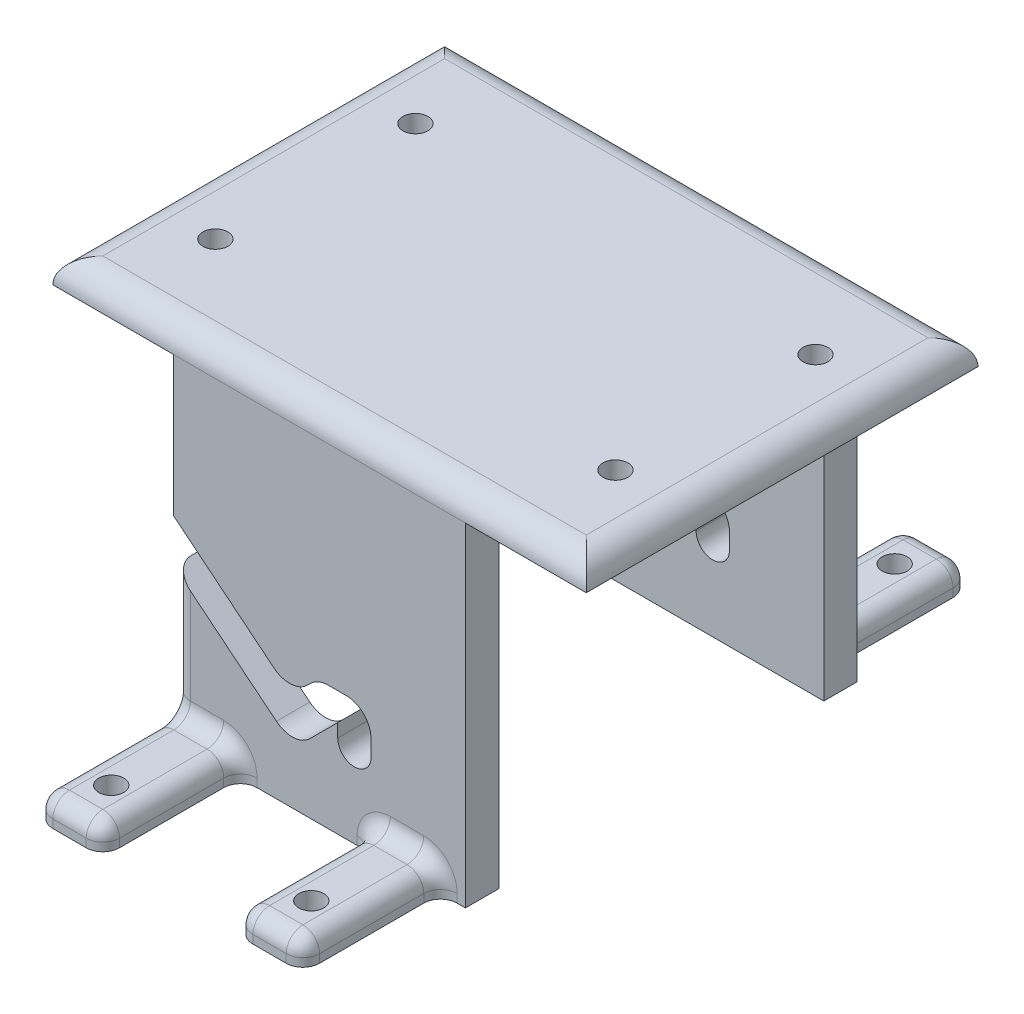
from build123d import *

# Parameters (mm, degrees)
CROQUIS1_W               = 38
CROQUIS1_H               = 62
SALIENTE_EXTRUIR1_DEPTH  = 3
CROQUIS2_R               = 1.5
CORTAR_EXTRUIR1_DEPTH    = 73.780491892
SALIENTE_EXTRUIR2_DEPTH  = 40
REDONDEO2_DEPTH          = 38
REDONDEO2_START          = -1
REDONDEO2_2_DEPTH        = 64
CROQUIS8_W               = 7
CROQUIS8_H               = 7
SALIENTE_EXTRUIR6_DEPTH  = 3
CROQUIS12_R              = 1.5
CROQUIS12_W              = 3
CROQUIS12_H              = 6
CORTAR_EXTRUIR6_DEPTH    = 40
CROQUIS14_W              = 18
CROQUIS14_H              = 20
SALIENTE_EXTRUIR7_DEPTH  = 3
CROQUIS15_W              = 18
CROQUIS15_H              = 20
SALIENTE_EXTRUIR8_DEPTH  = 3
CROQUIS17_W              = 38
CROQUIS17_H              = 2
SALIENTE_EXTRUIR9_DEPTH  = 40
CORTAR_EXTRUIR7_DEPTH    = 89.345911054
REDONDEO3_R              = 3
CROQUIS18_W              = 3
CROQUIS18_H              = 2
CORTAR_EXTRUIR8_DEPTH    = 40
CROQUIS19_W              = 18
CROQUIS19_H              = 20
CORTAR_EXTRUIR9_DEPTH    = 3
CROQUIS20_W              = 18
CROQUIS20_H              = 20
CORTAR_EXTRUIR10_DEPTH   = 3
SALIENTE_EXTRUIR10_DEPTH = 3
SALIENTE_EXTRUIR11_DEPTH = 3
REDONDEO4_R              = 1
CROQUIS23_W              = 62
CROQUIS23_H              = 3
CORTAR_EXTRUIR11_DEPTH   = 88.097646352
CROQUIS24_W              = 64
CROQUIS24_H              = 47
SALIENTE_EXTRUIR12_DEPTH = 3
REDONDEO5_R              = 3
SALIENTE_EXTRUIR13_DEPTH = 2
SALIENTE_EXTRUIR14_DEPTH = 2
CROQUIS27_W              = 8
CROQUIS27_H              = 3
SALIENTE_EXTRUIR15_DEPTH = 16.5
CROQUIS28_R              = 1.5
CORTAR_EXTRUIR12_DEPTH   = 97.939414069
CROQUIS29_W              = 8
CROQUIS29_H              = 3
SALIENTE_EXTRUIR16_DEPTH = 16.5
CROQUIS30_R              = 1.5
CORTAR_EXTRUIR13_DEPTH   = 97.939414069
REDONDEO6_R              = 2
CROQUIS31_R              = 1.5
CORTAR_EXTRUIR14_DEPTH   = 99.21532467


with BuildPart() as part:
    # Croquis1 → Saliente-Extruir1 (new body)
    with BuildSketch(Plane(origin=(0, 0, 0), x_dir=(1, 0, 0), z_dir=(0, 1, 0))):
        with Locations((19, -31)):
            Rectangle(CROQUIS1_W, CROQUIS1_H)
    extrude(amount=SALIENTE_EXTRUIR1_DEPTH)

    # Croquis2 → Cortar-Extruir1 (cut, through all)
    with BuildSketch(Plane(origin=(0, 3, 0), x_dir=(1, 0, 0), z_dir=(0, 1, 0))):
        with Locations(Location((7, -7, 0), (0, 0, 270))):
            Circle(CROQUIS2_R)
        with Locations(Location((31, -7, 0), (0, 0, 270))):
            Circle(CROQUIS2_R)
        with Locations(Location((7, -55, 0), (0, 0, 270))):
            Circle(CROQUIS2_R)
        with Locations(Location((31, -55, 0), (0, 0, 270))):
            Circle(CROQUIS2_R)
    extrude(amount=-CORTAR_EXTRUIR1_DEPTH, mode=Mode.SUBTRACT)

    # Croquis3 → Saliente-Extruir2 (add)
    with BuildSketch(Plane.XZ):
        Polygon((38, 62), (38, 56), (35, 56), (35, 59), (28, 59), (28, 62), align=None)
        Polygon((0, 62), (10, 62), (10, 59), (3, 59), (3, 56), (0, 56), align=None)
        Polygon((0, 6), (0, 0), (10, 0), (10, 3), (3, 3), (3, 6), align=None)
        Polygon((28, 0), (38, 0), (38, 6), (35, 6), (35, 3), (28, 3), align=None)
    extrude(amount=SALIENTE_EXTRUIR2_DEPTH)

    # Redondeo2: read off the stored shape, not the designer's step
    # Redondeo2 outline → Redondeo2 (cut)
    with BuildSketch(Plane.YZ):
        with BuildLine():
            ThreePointArc((0, 62), (2.121320344, 61.121320344), (3, 59))
            Line((3, 59), (3, 62))
            Line((3, 62), (0, 62))
        make_face()
        with BuildLine():
            ThreePointArc((3, 3), (2.121320344, 0.878679656), (0, 0))
            Line((0, 0), (3, 0))
            Line((3, 0), (3, 3))
        make_face()
    extrude(amount=REDONDEO2_DEPTH, mode=Mode.SUBTRACT)

    # Redondeo2 2 outline → Redondeo2 2 (cut)
    with BuildSketch(Plane.XY.offset(REDONDEO2_START)):
        with BuildLine():
            Line((0, 3), (0, 0))
            ThreePointArc((0, 0), (0.878679656, 2.121320344), (3, 3))
            Line((3, 3), (0, 3))
        make_face()
        with BuildLine():
            Line((38, 3), (35, 3))
            ThreePointArc((35, 3), (37.121320344, 2.121320344), (38, 0))
            Line((38, 0), (38, 3))
        make_face()
    extrude(amount=REDONDEO2_2_DEPTH, mode=Mode.SUBTRACT)

    # Croquis8 → Saliente-Extruir6 (add)
    with BuildSketch(Plane.XZ.offset(40)):
        with Locations((6.5, 65.5)):
            Rectangle(CROQUIS8_W, CROQUIS8_H)
        with Locations((31.5, 65.5)):
            Rectangle(CROQUIS8_W, CROQUIS8_H)
        with Locations((31.5, -3.5)):
            Rectangle(CROQUIS8_W, CROQUIS8_H)
        with Locations((6.5, -3.5)):
            Rectangle(CROQUIS8_W, CROQUIS8_H)
    extrude(amount=-SALIENTE_EXTRUIR6_DEPTH)

    # Croquis12 → Cortar-Extruir6 (cut)
    with BuildSketch(Plane.XZ.offset(40)):
        with Locations(Location((7, -4, 0), (0, 0, 270))):
            Circle(CROQUIS12_R)
        with Locations(Location((31, -4, 0), (0, 0, 270))):
            Circle(CROQUIS12_R)
        with Locations(Location((31, 66, 0), (0, 0, 270))):
            Circle(CROQUIS12_R)
        with Locations(Location((7, 66, 0), (0, 0, 270))):
            Circle(CROQUIS12_R)
        with Locations((36.5, 3)):
            Rectangle(CROQUIS12_W, CROQUIS12_H)
        with Locations((36.5, 59)):
            Rectangle(CROQUIS12_W, CROQUIS12_H)
        with Locations((1.5, 59)):
            Rectangle(CROQUIS12_W, CROQUIS12_H)
        with Locations((1.5, 3)):
            Rectangle(CROQUIS12_W, CROQUIS12_H)
    extrude(amount=-CORTAR_EXTRUIR6_DEPTH, mode=Mode.SUBTRACT)

    # Croquis14 → Saliente-Extruir7 (add)
    with BuildSketch(Plane(origin=(0, 0, 59), x_dir=(-1, 0, 0), z_dir=(0, 0, -1))):
        with Locations((-19, -30)):
            Rectangle(CROQUIS14_W, CROQUIS14_H)
    extrude(amount=-SALIENTE_EXTRUIR7_DEPTH)

    # Croquis15 → Saliente-Extruir8 (add)
    with BuildSketch(Plane.XY.offset(3)):
        with Locations((19, -30)):
            Rectangle(CROQUIS15_W, CROQUIS15_H)
    extrude(amount=-SALIENTE_EXTRUIR8_DEPTH)

    # Croquis17 → Saliente-Extruir9 (add)
    with BuildSketch(Plane.XZ):
        with Locations((19, 10.5)):
            Rectangle(CROQUIS17_W, CROQUIS17_H)
        with Locations((19, 51.5)):
            Rectangle(CROQUIS17_W, CROQUIS17_H)
    extrude(amount=SALIENTE_EXTRUIR9_DEPTH)

    # Croquis16 → Cortar-Extruir7 (cut, through all)
    with BuildSketch(Plane(origin=(0, 0, 0), x_dir=(-1, 0, 0), z_dir=(0, 0, -1))):
        with BuildLine():
            Line((-17.42778873, -33.646749521), (-3, -21.929542881))
            Line((-3, -21.929542881), (-3, -16.776599839))
            Line((-3, -16.776599839), (-17.113112675, -28.238249343))
            Line((-17.113112675, -28.238249343), (-20.299570201, -25.079703159))
            Line((-20.299570201, -25.079703159), (-26.67778873, -25.079703159))
            Line((-26.67778873, -25.079703159), (-26.67778873, -30))
            ThreePointArc((-26.67778873, -30), (-24.67778873, -32), (-22.67778873, -30))
            Line((-22.67778873, -30), (-22.67778873, -28.396749521))
            Line((-22.67778873, -28.396749521), (-17.42778873, -33.646749521))
        make_face()
    extrude(amount=-CORTAR_EXTRUIR7_DEPTH, mode=Mode.SUBTRACT)

    # Redondeo3
    redondeo3_edges = [part.edges().sort_by_distance(p)[0] for p in [
        (26.67778873, -25.079703159, 60.5),
        (26.67778873, -25.079703159, 1.5),
        (26.67778873, -25.079703159, 10.5),
        (26.67778873, -25.079703159, 51.5),
        (20.299570201, -25.079703159, 60.5),
        (20.299570201, -25.079703159, 1.5),
        (20.299570201, -25.079703159, 10.5),
        (20.299570201, -25.079703159, 51.5),
        (17.113112675, -28.238249343, 60.5),
        (17.113112675, -28.238249343, 1.5),
        (17.113112675, -28.238249343, 10.5),
        (17.113112675, -28.238249343, 51.5),
        (17.42778873, -33.646749521, 60.5),
        (17.42778873, -33.646749521, 1.5),
        (17.42778873, -33.646749521, 10.5),
        (17.42778873, -33.646749521, 51.5),
    ]]
    fillet(redondeo3_edges, radius=REDONDEO3_R)

    # Croquis18 → Cortar-Extruir8 (cut)
    with BuildSketch(Plane.XZ.offset(40)):
        with Locations((1.5, 51.5)):
            Rectangle(CROQUIS18_W, CROQUIS18_H)
        with Locations((1.5, 10.5)):
            Rectangle(CROQUIS18_W, CROQUIS18_H)
    extrude(amount=-CORTAR_EXTRUIR8_DEPTH, mode=Mode.SUBTRACT)

    # Croquis19 → Cortar-Extruir9 (cut)
    with BuildSketch(Plane(origin=(0, 0, 0), x_dir=(-1, 0, 0), z_dir=(0, 0, -1))):
        with Locations((-19, -30)):
            Rectangle(CROQUIS19_W, CROQUIS19_H)
    extrude(amount=-CORTAR_EXTRUIR9_DEPTH, mode=Mode.SUBTRACT)


with BuildPart() as cortar_extruir9_piece_1:
    # of the separate pieces the step leaves, piece 1, a body of its own (cortar_extruir9_pieces)
    add(part.part.solids().sort_by_distance((3, -16.776599839, 0))[0])

    # Croquis20 → Cortar-Extruir10 (cut)
    with BuildSketch(Plane.XY.offset(62)):
        with Locations((19, -30)):
            Rectangle(CROQUIS20_W, CROQUIS20_H)
    extrude(amount=-CORTAR_EXTRUIR10_DEPTH, mode=Mode.SUBTRACT)


with BuildPart() as cortar_extruir9_piece_2:
    # of the separate pieces the step leaves, piece 2, a body of its own (cortar_extruir9_pieces)
    add(part.part.solids().sort_by_distance((10, -27.614436666, 0))[0])



with BuildPart() as cortar_extruir10_piece_1:
    # of the separate pieces the step leaves, piece 1, a body of its own (cortar_extruir10_pieces)
    add(cortar_extruir9_piece_1.part.solids().sort_by_distance((3, -16.776599839, 0))[0])



with BuildPart() as cortar_extruir10_piece_2:
    # of the separate pieces the step leaves, piece 2, a body of its own (cortar_extruir10_pieces)
    add(cortar_extruir9_piece_1.part.solids().sort_by_distance((10, -27.614436666, 59))[0])


with BuildPart() as cortar_extruir10_piece_1_1:
    add(cortar_extruir10_piece_1.part)

    add(cortar_extruir10_piece_2.part)  # Saliente-Extruir10 merges Cortar-Extruir10 piece 2
    # Croquis21 → Saliente-Extruir10 (add)
    with BuildSketch(Plane.XY.offset(62)):
        Polygon((3, -16.776599839), (3, -21.929542881), (10, -27.614436666), (10, -22.461493624), align=None)
    extrude(amount=-SALIENTE_EXTRUIR10_DEPTH)


with BuildPart() as cortar_extruir9_piece_2_1:
    add(cortar_extruir9_piece_2.part)

    add(cortar_extruir10_piece_1_1.part)  # Saliente-Extruir11 merges Cortar-Extruir10 piece 1
    # Croquis22 → Saliente-Extruir11 (add)
    with BuildSketch(Plane(origin=(0, 0, 0), x_dir=(-1, 0, 0), z_dir=(0, 0, -1))):
        Polygon((-10, -22.461493624), (-3, -16.776599839), (-3, -21.929542881), (-10, -27.614436666), align=None)
    extrude(amount=-SALIENTE_EXTRUIR11_DEPTH)

    # Redondeo4
    # the kernel refuses this fillet: 1 mm, written as the material it adds along each edge
    with BuildSketch(Plane(origin=(10, -37, 0), x_dir=(0, 1, 0), z_dir=(-1, 0, 0)), Plane(origin=(28, -37, 62), x_dir=(0, 1, 0), z_dir=(1, 0, 0))) as redondeo4_piece_1:
        with BuildLine():
            CenterArc((REDONDEO4_R, REDONDEO4_R), REDONDEO4_R, 180, 90)
            Line((0, REDONDEO4_R), (0, 0))
            Line((0, 0), (REDONDEO4_R, 0))
        make_face()
    extrude(amount=7)
    with BuildSketch(Plane(origin=(28, -37, 0), x_dir=(0, 1, 0), z_dir=(1, 0, 0)), Plane(origin=(10, -37, 62), x_dir=(0, 1, 0), z_dir=(-1, 0, 0))) as redondeo4_piece_2:
        with BuildLine():
            CenterArc((REDONDEO4_R, -REDONDEO4_R), REDONDEO4_R, 90, 90)
            Line((0, -REDONDEO4_R), (0, 0))
            Line((0, 0), (REDONDEO4_R, 0))
        make_face()
    extrude(amount=7)
    # the kernel refuses this fillet: 1 mm, written as the material it takes off along each edge
    with BuildSketch(Plane(origin=(0.5, -37, -7), x_dir=(0, -1, 0), z_dir=(1, 0, 0)), Plane(origin=(37.5, -37, 69), x_dir=(0, -1, 0), z_dir=(-1, 0, 0))) as redondeo4_2_piece_1:
        with BuildLine():
            CenterArc((REDONDEO4_R, -REDONDEO4_R), REDONDEO4_R, 90, 90)
            Line((0, -REDONDEO4_R), (0, 0))
            Line((0, 0), (REDONDEO4_R, 0))
        make_face()
    extrude(amount=12, mode=Mode.SUBTRACT)
    with BuildSketch(Plane(origin=(10, -42.5, -7), x_dir=(0, 0, 1), z_dir=(0, 1, 0)), Plane(origin=(28, -42.5, 69), x_dir=(0, 0, -1), z_dir=(0, 1, 0)), Plane(origin=(35, -42.5, -7), x_dir=(0, 0, 1), z_dir=(0, 1, 0)), Plane(origin=(3, -42.5, 69), x_dir=(0, 0, -1), z_dir=(0, 1, 0))) as redondeo4_2_piece_2:
        with BuildLine():
            CenterArc((REDONDEO4_R, -REDONDEO4_R), REDONDEO4_R, 90, 90)
            Line((0, -REDONDEO4_R), (0, 0))
            Line((0, 0), (REDONDEO4_R, 0))
        make_face()
    extrude(amount=8, mode=Mode.SUBTRACT)
    with BuildSketch(Plane(origin=(3, -42.5, -7), x_dir=(0, 0, 1), z_dir=(0, 1, 0)), Plane(origin=(28, -42.5, -7), x_dir=(0, 0, 1), z_dir=(0, 1, 0)), Plane(origin=(10, -42.5, 69), x_dir=(0, 0, -1), z_dir=(0, 1, 0)), Plane(origin=(35, -42.5, 69), x_dir=(0, 0, -1), z_dir=(0, 1, 0))) as redondeo4_2_piece_3:
        with BuildLine():
            CenterArc((REDONDEO4_R, REDONDEO4_R), REDONDEO4_R, 180, 90)
            Line((0, REDONDEO4_R), (0, 0))
            Line((0, 0), (REDONDEO4_R, 0))
        make_face()
    extrude(amount=8, mode=Mode.SUBTRACT)
    with BuildSketch(Plane(origin=(37.5, -37, -7), x_dir=(0, -1, 0), z_dir=(-1, 0, 0)), Plane(origin=(0.5, -37, 69), x_dir=(0, -1, 0), z_dir=(1, 0, 0))) as redondeo4_2_piece_4:
        with BuildLine():
            CenterArc((REDONDEO4_R, REDONDEO4_R), REDONDEO4_R, 180, 90)
            Line((0, REDONDEO4_R), (0, 0))
            Line((0, 0), (REDONDEO4_R, 0))
        make_face()
    extrude(amount=12, mode=Mode.SUBTRACT)
    # the kernel refuses this fillet: 1 mm, written as the material it takes off along each edge
    with BuildSketch(Plane(origin=(34, -38, -6), x_dir=(0, 1, 0), z_dir=(1, 0, 0))) as redondeo4_3_piece_1_section:
        Polygon((0, 0), (REDONDEO4_R, 0), (REDONDEO4_R, -REDONDEO4_R), (0, -REDONDEO4_R), align=None)
    redondeo4_3_piece_1 = extrude(amount=REDONDEO4_R, mode=Mode.PRIVATE)
    redondeo4_3_piece_1 = redondeo4_3_piece_1 - Plane(origin=(34, -38, -6), x_dir=(0, -0.7071067811865475, 0.7071067811865475), z_dir=(1, 0, 0)) * Sphere(REDONDEO4_R, mode=Mode.PRIVATE)
    add(redondeo4_3_piece_1, mode=Mode.SUBTRACT)
    with BuildSketch(Plane(origin=(34, -38, 68), x_dir=(0, 1, 0), z_dir=(1, 0, 0))) as redondeo4_3_piece_2_section:
        Polygon((0, 0), (REDONDEO4_R, 0), (REDONDEO4_R, REDONDEO4_R), (0, REDONDEO4_R), align=None)
    redondeo4_3_piece_2 = extrude(amount=REDONDEO4_R, mode=Mode.PRIVATE)
    redondeo4_3_piece_2 = redondeo4_3_piece_2 - Plane(origin=(34, -38, 68), x_dir=(0, -0.7071067811865475, -0.7071067811865475), z_dir=(1, 0, 0)) * Sphere(REDONDEO4_R, mode=Mode.PRIVATE)
    add(redondeo4_3_piece_2, mode=Mode.SUBTRACT)
    with BuildSketch(Plane(origin=(9, -38, 68), x_dir=(0, 1, 0), z_dir=(1, 0, 0))) as redondeo4_3_piece_3_section:
        Polygon((0, 0), (REDONDEO4_R, 0), (REDONDEO4_R, REDONDEO4_R), (0, REDONDEO4_R), align=None)
    redondeo4_3_piece_3 = extrude(amount=REDONDEO4_R, mode=Mode.PRIVATE)
    redondeo4_3_piece_3 = redondeo4_3_piece_3 - Plane(origin=(9, -38, 68), x_dir=(0, -0.7071067811865475, -0.7071067811865475), z_dir=(1, 0, 0)) * Sphere(REDONDEO4_R, mode=Mode.PRIVATE)
    add(redondeo4_3_piece_3, mode=Mode.SUBTRACT)
    with BuildSketch(Plane(origin=(29, -38, 68), x_dir=(0, 1, 0), z_dir=(-1, 0, 0))) as redondeo4_3_piece_4_section:
        Polygon((0, 0), (REDONDEO4_R, 0), (REDONDEO4_R, -REDONDEO4_R), (0, -REDONDEO4_R), align=None)
    redondeo4_3_piece_4 = extrude(amount=REDONDEO4_R, mode=Mode.PRIVATE)
    redondeo4_3_piece_4 = redondeo4_3_piece_4 - Plane(origin=(29, -38, 68), x_dir=(0, -0.7071067811865475, -0.7071067811865475), z_dir=(-1, 0, 0)) * Sphere(REDONDEO4_R, mode=Mode.PRIVATE)
    add(redondeo4_3_piece_4, mode=Mode.SUBTRACT)
    with BuildSketch(Plane(origin=(29, -38, -6), x_dir=(0, 1, 0), z_dir=(-1, 0, 0))) as redondeo4_3_piece_5_section:
        Polygon((0, 0), (REDONDEO4_R, 0), (REDONDEO4_R, REDONDEO4_R), (0, REDONDEO4_R), align=None)
    redondeo4_3_piece_5 = extrude(amount=REDONDEO4_R, mode=Mode.PRIVATE)
    redondeo4_3_piece_5 = redondeo4_3_piece_5 - Plane(origin=(29, -38, -6), x_dir=(0, -0.7071067811865475, 0.7071067811865475), z_dir=(-1, 0, 0)) * Sphere(REDONDEO4_R, mode=Mode.PRIVATE)
    add(redondeo4_3_piece_5, mode=Mode.SUBTRACT)
    with BuildSketch(Plane(origin=(4, -38, 68), x_dir=(0, 1, 0), z_dir=(-1, 0, 0))) as redondeo4_3_piece_6_section:
        Polygon((0, 0), (REDONDEO4_R, 0), (REDONDEO4_R, -REDONDEO4_R), (0, -REDONDEO4_R), align=None)
    redondeo4_3_piece_6 = extrude(amount=REDONDEO4_R, mode=Mode.PRIVATE)
    redondeo4_3_piece_6 = redondeo4_3_piece_6 - Plane(origin=(4, -38, 68), x_dir=(0, -0.7071067811865475, -0.7071067811865475), z_dir=(-1, 0, 0)) * Sphere(REDONDEO4_R, mode=Mode.PRIVATE)
    add(redondeo4_3_piece_6, mode=Mode.SUBTRACT)
    with BuildSketch(Plane(origin=(4, -38, -6), x_dir=(0, 1, 0), z_dir=(-1, 0, 0))) as redondeo4_3_piece_7_section:
        Polygon((0, 0), (REDONDEO4_R, 0), (REDONDEO4_R, REDONDEO4_R), (0, REDONDEO4_R), align=None)
    redondeo4_3_piece_7 = extrude(amount=REDONDEO4_R, mode=Mode.PRIVATE)
    redondeo4_3_piece_7 = redondeo4_3_piece_7 - Plane(origin=(4, -38, -6), x_dir=(0, -0.7071067811865475, 0.7071067811865475), z_dir=(-1, 0, 0)) * Sphere(REDONDEO4_R, mode=Mode.PRIVATE)
    add(redondeo4_3_piece_7, mode=Mode.SUBTRACT)
    with BuildSketch(Plane(origin=(9, -38, -6), x_dir=(0, 1, 0), z_dir=(1, 0, 0))) as redondeo4_3_piece_8_section:
        Polygon((0, 0), (REDONDEO4_R, 0), (REDONDEO4_R, -REDONDEO4_R), (0, -REDONDEO4_R), align=None)
    redondeo4_3_piece_8 = extrude(amount=REDONDEO4_R, mode=Mode.PRIVATE)
    redondeo4_3_piece_8 = redondeo4_3_piece_8 - Plane(origin=(9, -38, -6), x_dir=(0, -0.7071067811865475, 0.7071067811865475), z_dir=(1, 0, 0)) * Sphere(REDONDEO4_R, mode=Mode.PRIVATE)
    add(redondeo4_3_piece_8, mode=Mode.SUBTRACT)
    with BuildSketch(Plane(origin=(10, -37, -6), x_dir=(0, -1, 0), z_dir=(0, 0, 1)), Plane(origin=(3, -37, -1), x_dir=(0, -1, 0), z_dir=(0, 0, -1)), Plane(origin=(28, -37, 68), x_dir=(0, -1, 0), z_dir=(0, 0, -1)), Plane(origin=(35, -37, 63), x_dir=(0, -1, 0), z_dir=(0, 0, 1))) as redondeo4_3_piece_9:
        with BuildLine():
            CenterArc((REDONDEO4_R, -REDONDEO4_R), REDONDEO4_R, 90, 90)
            Line((0, -REDONDEO4_R), (0, 0))
            Line((0, 0), (REDONDEO4_R, 0))
        make_face()
    extrude(amount=5, mode=Mode.SUBTRACT)
    with BuildSketch(Plane(origin=(3, 0, 0), x_dir=(0, 0, 1), z_dir=(0, -1, 0)), Plane(origin=(10, -36, 0), x_dir=(0, 0, 1), z_dir=(0, 1, 0)), Plane(origin=(35, -36, 0), x_dir=(0, 0, 1), z_dir=(0, 1, 0)), Plane(origin=(28, -36, 62), x_dir=(0, 0, -1), z_dir=(0, 1, 0)), Plane(origin=(3, -36, 62), x_dir=(0, 0, -1), z_dir=(0, 1, 0)), Plane(origin=(10, 0, 62), x_dir=(0, 0, -1), z_dir=(0, -1, 0))) as redondeo4_3_piece_10:
        with BuildLine():
            CenterArc((REDONDEO4_R, -REDONDEO4_R), REDONDEO4_R, 90, 90)
            Line((0, -REDONDEO4_R), (0, 0))
            Line((0, 0), (REDONDEO4_R, 0))
        make_face()
    extrude(amount=36, mode=Mode.SUBTRACT)
    with BuildSketch(Plane(origin=(28, -36, 0), x_dir=(0, 0, 1), z_dir=(0, 1, 0)), Plane(origin=(35, -36, 62), x_dir=(0, 0, -1), z_dir=(0, 1, 0))) as redondeo4_3_piece_11:
        with BuildLine():
            CenterArc((REDONDEO4_R, REDONDEO4_R), REDONDEO4_R, 180, 90)
            Line((0, REDONDEO4_R), (0, 0))
            Line((0, 0), (REDONDEO4_R, 0))
        make_face()
    extrude(amount=36, mode=Mode.SUBTRACT)
    with BuildSketch(Plane(origin=(3, -37, 63), x_dir=(0, -1, 0), z_dir=(0, 0, 1)), Plane(origin=(28, -37, -6), x_dir=(0, -1, 0), z_dir=(0, 0, 1)), Plane(origin=(10, -37, 68), x_dir=(0, -1, 0), z_dir=(0, 0, -1)), Plane(origin=(35, -37, -1), x_dir=(0, -1, 0), z_dir=(0, 0, -1))) as redondeo4_3_piece_12:
        with BuildLine():
            CenterArc((REDONDEO4_R, REDONDEO4_R), REDONDEO4_R, 180, 90)
            Line((0, REDONDEO4_R), (0, 0))
            Line((0, 0), (REDONDEO4_R, 0))
        make_face()
    extrude(amount=5, mode=Mode.SUBTRACT)
    with BuildSketch(Plane(origin=(35, -36, -1), x_dir=(0, 0, 1), z_dir=(0, 1, 0))) as redondeo4_3_piece_13:
        with BuildLine():
            CenterArc((1 + REDONDEO4_R, -REDONDEO4_R), REDONDEO4_R, 90, 90)
            Line((1, -REDONDEO4_R), (1, 0))
            Line((1, 0), (1 + REDONDEO4_R, 0))
        make_face()
    revolve(axis=Axis((35, -36, -1), (1, 0, 0)), revolution_arc=90, mode=Mode.SUBTRACT)
    with BuildSketch(Plane(origin=(35, -36, 63), x_dir=(0, 0, -1), z_dir=(0, 1, 0))) as redondeo4_3_piece_14:
        with BuildLine():
            CenterArc((1 + REDONDEO4_R, REDONDEO4_R), REDONDEO4_R, 180, 90)
            Line((1, REDONDEO4_R), (1, 0))
            Line((1, 0), (1 + REDONDEO4_R, 0))
        make_face()
    revolve(axis=Axis((35, -36, 63), (-1, 0, 0)), revolution_arc=90, mode=Mode.SUBTRACT)
    with BuildSketch(Plane(origin=(10, -36, 63), x_dir=(0, 0, -1), z_dir=(0, 1, 0))) as redondeo4_3_piece_15:
        with BuildLine():
            CenterArc((1 + REDONDEO4_R, REDONDEO4_R), REDONDEO4_R, 180, 90)
            Line((1, REDONDEO4_R), (1, 0))
            Line((1, 0), (1 + REDONDEO4_R, 0))
        make_face()
    revolve(axis=Axis((10, -36, 63), (-1, 0, 0)), revolution_arc=90, mode=Mode.SUBTRACT)
    with BuildSketch(Plane(origin=(3, -36, 63), x_dir=(0, 0, -1), z_dir=(0, 1, 0))) as redondeo4_3_piece_16:
        with BuildLine():
            CenterArc((1 + REDONDEO4_R, -REDONDEO4_R), REDONDEO4_R, 90, 90)
            Line((1, -REDONDEO4_R), (1, 0))
            Line((1, 0), (1 + REDONDEO4_R, 0))
        make_face()
    revolve(axis=Axis((3, -36, 63), (-1, 0, 0)), revolution_arc=90, mode=Mode.SUBTRACT)
    with BuildSketch(Plane(origin=(28, -36, 63), x_dir=(0, 0, -1), z_dir=(0, 1, 0))) as redondeo4_3_piece_17:
        with BuildLine():
            CenterArc((1 + REDONDEO4_R, -REDONDEO4_R), REDONDEO4_R, 90, 90)
            Line((1, -REDONDEO4_R), (1, 0))
            Line((1, 0), (1 + REDONDEO4_R, 0))
        make_face()
    revolve(axis=Axis((28, -36, 63), (-1, 0, 0)), revolution_arc=90, mode=Mode.SUBTRACT)
    with BuildSketch(Plane(origin=(28, -36, -1), x_dir=(0, 0, 1), z_dir=(0, 1, 0))) as redondeo4_3_piece_18:
        with BuildLine():
            CenterArc((1 + REDONDEO4_R, REDONDEO4_R), REDONDEO4_R, 180, 90)
            Line((1, REDONDEO4_R), (1, 0))
            Line((1, 0), (1 + REDONDEO4_R, 0))
        make_face()
    revolve(axis=Axis((28, -36, -1), (1, 0, 0)), revolution_arc=90, mode=Mode.SUBTRACT)
    with BuildSketch(Plane(origin=(10, -36, -1), x_dir=(0, 0, 1), z_dir=(0, 1, 0))) as redondeo4_3_piece_19:
        with BuildLine():
            CenterArc((1 + REDONDEO4_R, -REDONDEO4_R), REDONDEO4_R, 90, 90)
            Line((1, -REDONDEO4_R), (1, 0))
            Line((1, 0), (1 + REDONDEO4_R, 0))
        make_face()
    revolve(axis=Axis((10, -36, -1), (1, 0, 0)), revolution_arc=90, mode=Mode.SUBTRACT)
    with BuildSketch(Plane(origin=(3, -36, -1), x_dir=(0, 0, 1), z_dir=(0, 1, 0))) as redondeo4_3_piece_20:
        with BuildLine():
            CenterArc((1 + REDONDEO4_R, REDONDEO4_R), REDONDEO4_R, 180, 90)
            Line((1, REDONDEO4_R), (1, 0))
            Line((1, 0), (1 + REDONDEO4_R, 0))
        make_face()
    revolve(axis=Axis((3, -36, -1), (1, 0, 0)), revolution_arc=90, mode=Mode.SUBTRACT)

    # Croquis23 → Cortar-Extruir11 (cut, through all)
    with BuildSketch(Plane.ZY.offset(-3)):
        with Locations((31, 1.5)):
            Rectangle(CROQUIS23_W, CROQUIS23_H)
    extrude(amount=-CORTAR_EXTRUIR11_DEPTH, mode=Mode.SUBTRACT)


with BuildPart() as cortar_extruir11_piece_1:
    # of the separate pieces the step leaves, piece 1, a body of its own (cortar_extruir11_pieces_kept)
    add(cortar_extruir9_piece_2_1.part.solids().sort_by_distance((3, -16.776599839, 50.5))[0])



with BuildPart() as cortar_extruir11_piece_2:
    # of the separate pieces the step leaves, piece 2, a body of its own (cortar_extruir11_pieces_kept)
    add(cortar_extruir9_piece_2_1.part.solids().sort_by_distance((15.327975342, -31.941432938, 9.5))[0])


with BuildPart() as cortar_extruir11_piece_1_1:
    add(cortar_extruir11_piece_1.part)

    add(cortar_extruir11_piece_2.part)  # Saliente-Extruir12 merges Cortar-Extruir11 piece 2
    # Croquis24 → Saliente-Extruir12 (add)
    with BuildSketch(Plane(origin=(0, 0, 0), x_dir=(1, 0, 0), z_dir=(0, 1, 0))):
        with Locations((20.5, -31)):
            Rectangle(CROQUIS24_W, CROQUIS24_H)
    extrude(amount=SALIENTE_EXTRUIR12_DEPTH)

    # Redondeo5
    redondeo5_edges = [cortar_extruir11_piece_1_1.edges().sort_by_distance(p)[0] for p in [
        (20.5, 3, 54.5),
        (-11.5, 3, 31),
        (20.5, 3, 7.5),
        (52.5, 3, 31),
    ]]
    fillet(redondeo5_edges, radius=REDONDEO5_R - 0.0001)  # a hair under: the kernel refuses the full size

    # Croquis25 → Saliente-Extruir13 (add)
    with BuildSketch(Plane.XY.offset(52.5)):
        with BuildLine():
            Line((3, 0), (38, 0))
            Line((38, 0), (38, -40))
            Line((38, -40), (3, -40))
            Line((3, -40), (3, -21.929542881))
            Line((3, -21.929542881), (15.327975342, -31.941432938))
            ThreePointArc((15.327975342, -31.941432938), (17.374120883, -32.608665506), (19.34055125, -31.733987001))
            Line((19.34055125, -31.733987001), (22.67778873, -28.396749521))
            Line((22.67778873, -28.396749521), (22.67778873, -30))
            ThreePointArc((22.67778873, -30), (24.67778873, -32), (26.67778873, -30))
            Line((26.67778873, -30), (26.67778873, -28.079703159))
            ThreePointArc((26.67778873, -28.079703159), (25.799109074, -25.958382815), (23.67778873, -25.079703159))
            Line((23.67778873, -25.079703159), (21.534487429, -25.079703159))
            ThreePointArc((21.534487429, -25.079703159), (20.392536012, -25.305546177), (19.422519098, -25.949071852))
            Line((19.422519098, -25.949071852), (19.025791236, -26.34232463))
            ThreePointArc((19.025791236, -26.34232463), (17.062122932, -27.208025598), (15.02256734, -26.540459603))
            Line((15.02256734, -26.540459603), (3, -16.776599839))
            Line((3, -16.776599839), (3, 0))
        make_face()
    extrude(amount=SALIENTE_EXTRUIR13_DEPTH)

    # Croquis26 → Saliente-Extruir14 (add)
    with BuildSketch(Plane(origin=(0, 0, 9.5), x_dir=(-1, 0, 0), z_dir=(0, 0, -1))):
        with BuildLine():
            Line((-3, -16.776599839), (-3, 0))
            Line((-3, 0), (-38, 0))
            Line((-38, 0), (-38, -40))
            Line((-38, -40), (-3, -40))
            Line((-3, -40), (-3, -21.929542881))
            Line((-3, -21.929542881), (-15.327975342, -31.941432938))
            ThreePointArc((-15.327975342, -31.941432938), (-17.374120883, -32.608665506), (-19.34055125, -31.733987001))
            Line((-19.34055125, -31.733987001), (-22.67778873, -28.396749521))
            Line((-22.67778873, -28.396749521), (-22.67778873, -30))
            ThreePointArc((-22.67778873, -30), (-24.67778873, -32), (-26.67778873, -30))
            Line((-26.67778873, -30), (-26.67778873, -28.079703159))
            ThreePointArc((-26.67778873, -28.079703159), (-25.799109074, -25.958382815), (-23.67778873, -25.079703159))
            Line((-23.67778873, -25.079703159), (-21.534487429, -25.079703159))
            ThreePointArc((-21.534487429, -25.079703159), (-20.392536012, -25.305546177), (-19.422519098, -25.949071852))
            Line((-19.422519098, -25.949071852), (-19.025791236, -26.34232463))
            ThreePointArc((-19.025791236, -26.34232463), (-17.062122932, -27.208025598), (-15.02256734, -26.540459603))
            Line((-15.02256734, -26.540459603), (-3, -16.776599839))
        make_face()
    extrude(amount=SALIENTE_EXTRUIR14_DEPTH)

    # Croquis27 → Saliente-Extruir15 (add)
    with BuildSketch(Plane.XY.offset(54.5)):
        with Locations((7, -38.5)):
            Rectangle(CROQUIS27_W, CROQUIS27_H)
        with Locations((31, -38.5)):
            Rectangle(CROQUIS27_W, CROQUIS27_H)
    extrude(amount=SALIENTE_EXTRUIR15_DEPTH)

    # Croquis28 → Cortar-Extruir12 (cut, through all)
    with BuildSketch(Plane(origin=(0, -37, 0), x_dir=(1, 0, 0), z_dir=(0, 1, 0))):
        with Locations(Location((7, -66, 0), (0, 0, 270))):
            Circle(CROQUIS28_R)
        with Locations(Location((31, -66, 0), (0, 0, 270))):
            Circle(CROQUIS28_R)
    extrude(amount=-CORTAR_EXTRUIR12_DEPTH, mode=Mode.SUBTRACT)

    # Croquis29 → Saliente-Extruir16 (add)
    with BuildSketch(Plane(origin=(0, 0, 7.5), x_dir=(-1, 0, 0), z_dir=(0, 0, -1))):
        with Locations((-7, -38.5)):
            Rectangle(CROQUIS29_W, CROQUIS29_H)
        with Locations((-31, -38.5)):
            Rectangle(CROQUIS29_W, CROQUIS29_H)
    extrude(amount=SALIENTE_EXTRUIR16_DEPTH)

    # Croquis30 → Cortar-Extruir13 (cut, through all)
    with BuildSketch(Plane(origin=(0, -37, 0), x_dir=(1, 0, 0), z_dir=(0, 1, 0))):
        with Locations(Location((7, 4, 0), (0, 0, 180))):
            Circle(CROQUIS30_R)
        with Locations(Location((31, 4, 0), (0, 0, 180))):
            Circle(CROQUIS30_R)
    extrude(amount=-CORTAR_EXTRUIR13_DEPTH, mode=Mode.SUBTRACT)

    # Redondeo6
    redondeo6_edges = [cortar_extruir11_piece_1_1.edges().sort_by_distance(p)[0] for p in [
        (3, -37, 62.75),
        (11, -38.5, 54.5),
        (7, -37, 54.5),
        (11, -37, 62.75),
        (3, -38.5, 71),
        (11, -38.5, 71),
        (7, -37, 71),
        (35, -38.5, 54.5),
        (31, -37, 54.5),
        (35, -37, 62.75),
        (27, -38.5, 54.5),
        (27, -37, 62.75),
        (35, -38.5, 71),
        (31, -37, 71),
        (27, -38.5, 71),
        (3, -29.46477144, 7.5),
        (7, -37, 7.5),
        (3, -37, -0.75),
        (11, -38.5, 7.5),
        (11, -37, -0.75),
        (3, -38.5, -9),
        (7, -37, -9),
        (11, -38.5, -9),
        (27, -38.5, 7.5),
        (31, -37, 7.5),
        (27, -37, -0.75),
        (35, -38.5, 7.5),
        (35, -37, -0.75),
        (27, -38.5, -9),
        (31, -37, -9),
        (35, -38.5, -9),
        (3, -29.46477144, 54.5),
    ]]
    fillet(redondeo6_edges, radius=REDONDEO6_R)

    # Croquis31 → Cortar-Extruir14 (cut, through all)
    with BuildSketch(Plane(origin=(0, 3, 0), x_dir=(1, 0, 0), z_dir=(0, 1, 0))):
        with Locations(Location((-3.5, -19, 0), (0, 0, 270))):
            Circle(CROQUIS31_R)
        with Locations(Location((-3.5, -43, 0), (0, 0, 270))):
            Circle(CROQUIS31_R)
        with Locations(Location((44.5, -19, 0), (0, 0, 270))):
            Circle(CROQUIS31_R)
        with Locations(Location((44.5, -43, 0), (0, 0, 270))):
            Circle(CROQUIS31_R)
    extrude(amount=-CORTAR_EXTRUIR14_DEPTH, mode=Mode.SUBTRACT)


solid = cortar_extruir11_piece_1_1.part
